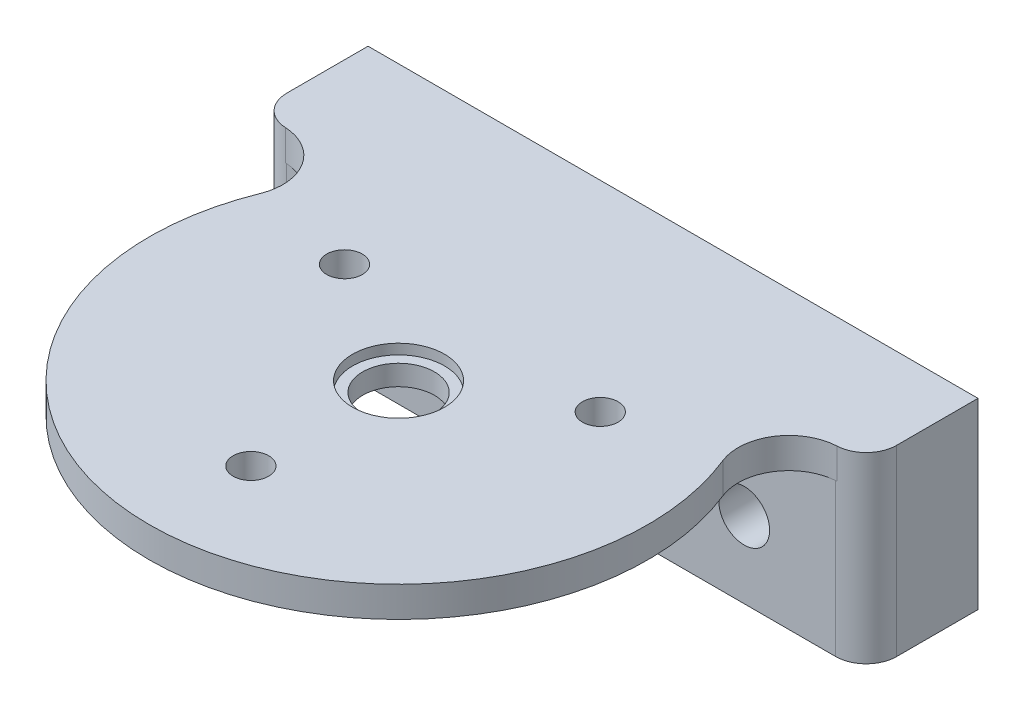
from build123d import *

# Parameters (mm, degrees)
SKETCH1_R                       = 4.525
SKETCH1_R_2                     = 3.525
BOSS_EXTRUDE1_DEPTH             = 2
SKETCH1_5_R                     = 24.525
SKETCH1_5_R_2                   = 4.525
BOSS_EXTRUDE3_DEPTH             = 3
SKETCH2_R                       = 1.75
CUT_EXTRUDE1_DEPTH              = 4.5
CIRPATTERN1_COUNT               = 3
SKETCH9_W                       = 60
SKETCH9_H                       = 11
BOSS_EXTRUDE7_DEPTH             = 15
BOSS_EXTRUDE7_DIRECTION_2_REACH = 36.813
CUT_EXTRUDE3_REACH              = 54.605
SKETCH10_R                      = 2.5
FILLET4_R                       = 3
FILLET5_R                       = 5


with BuildPart() as part:
    # Sketch1 → Boss-Extrude1 (new body)
    with BuildSketch(Plane(origin=(0, 0, 0), x_dir=(1, 0, 0), z_dir=(0, 1, 0))):
        with Locations(Location((0, 0, 0), (0, 0, 270))):
            Circle(SKETCH1_R)
        with Locations(Location((0, 0, 0), (0, 0, 270))):
            Circle(SKETCH1_R_2, mode=Mode.SUBTRACT)
    extrude(amount=BOSS_EXTRUDE1_DEPTH)

    # Sketch1<5> → Boss-Extrude3 (add)
    with BuildSketch(Plane(origin=(0, 0, 0), x_dir=(1, 0, 0), z_dir=(0, 1, 0))):
        with Locations(Location((0, 0, 0), (0, 0, 270))):
            Circle(SKETCH1_5_R)
        with Locations(Location((0, 0, 0), (0, 0, 270))):
            Circle(SKETCH1_5_R_2, mode=Mode.SUBTRACT)
    extrude(amount=BOSS_EXTRUDE3_DEPTH)

    # Sketch2 → Cut-Extrude1 (cut)
    with BuildSketch(Plane(origin=(0, 3, 0), x_dir=(1, 0, 0), z_dir=(0, 1, 0))):
        with Locations(Location((0, -14.525, 0), (0, 0, 270))):
            Circle(SKETCH2_R)
    cut_extrude1 = extrude(amount=-CUT_EXTRUDE1_DEPTH, mode=Mode.SUBTRACT)

    # CirPattern1: Cut-Extrude1 ×3 about axis
    cirpattern1_axis = Axis((0, 0, 0), (0, 1, 0))
    for i in range(1, CIRPATTERN1_COUNT):
        add(cut_extrude1.rotate(cirpattern1_axis, i * 360 / CIRPATTERN1_COUNT), mode=Mode.SUBTRACT)

    # Sketch9 → Boss-Extrude7 (add)
    with BuildSketch(Plane.XZ):
        with Locations((0, -21.5)):
            Rectangle(SKETCH9_W, SKETCH9_H)
    extrude(amount=BOSS_EXTRUDE7_DEPTH)

    # Boss-Extrude7 direction 2: up to this face of the body (flat: up to its plane)
    boss_extrude7_direction_2_end = Plane(part.part.faces().sort_by_distance((0, 3, -23.831328248))[0])
    # Sketch9 → Boss-Extrude7 direction 2 (add, up to the picked face)
    with BuildSketch(Plane.XZ, mode=Mode.PRIVATE) as boss_extrude7_direction_2_sk1:
        with Locations((0, -21.5)):
            Rectangle(SKETCH9_W, SKETCH9_H)
    boss_extrude7_direction_2_tool1 = split(extrude(boss_extrude7_direction_2_sk1.sketch, amount=-BOSS_EXTRUDE7_DIRECTION_2_REACH, mode=Mode.PRIVATE), bisect_by=boss_extrude7_direction_2_end, keep=Keep.BOTH, mode=Mode.PRIVATE)
    add(boss_extrude7_direction_2_tool1.solids().sort_by(Axis((0, 0, -21.5), (0, 1, 0)))[0])

    # Sketch10 → Cut-Extrude3 (cut, up to next)
    with BuildSketch(Plane.XY.offset(-16), mode=Mode.PRIVATE) as cut_extrude3_sk1:
        with Locations((-18, -7.5)):
            Circle(SKETCH10_R)
    cut_extrude3_tool1 = extrude(cut_extrude3_sk1.sketch, amount=-CUT_EXTRUDE3_REACH, mode=Mode.PRIVATE) & part.part
    # Sketch10 → Cut-Extrude3 (cut, up to next)
    with BuildSketch(Plane.XY.offset(-16), mode=Mode.PRIVATE) as cut_extrude3_sk2:
        with Locations(Location((18, -7.5, 0), (0, 0, 180))):
            Circle(SKETCH10_R)
    cut_extrude3_tool2 = extrude(cut_extrude3_sk2.sketch, amount=-CUT_EXTRUDE3_REACH, mode=Mode.PRIVATE) & part.part
    add(cut_extrude3_tool1.solids().sort_by_distance((-18, -7.5, -16))[0], mode=Mode.SUBTRACT)
    add(cut_extrude3_tool2.solids().sort_by_distance((18, -7.5, -16))[0], mode=Mode.SUBTRACT)

    # Fillet4
    fillet4_edges = [part.edges().sort_by_distance(p)[0] for p in [
        (-30, -6, -16),
        (30, -6, -16),
    ]]
    fillet(fillet4_edges, radius=FILLET4_R)

    # Fillet5
    # the kernel refuses this fillet: 5 mm, written as the material it adds along each edge
    with BuildSketch(Plane(origin=(-18.586974606, 3, -16), x_dir=(-0.999999908254526, 0, -0.0004283584240869523), z_dir=(0, -1, 0))) as fillet5_piece_1:
        with BuildLine():
            CenterArc((8.806331501, -4.993993224), FILLET5_R, 92.808774222, 109.061067494)
            Line((4.166169243, -6.856489993), (3.702153017, -7.04273967))
            ThreePointArc((3.702153017, -7.04273967), (1.938057952, -3.516366711), (-0.379079034, -0.326035406))
            Line((-0.379079034, -0.326035406), (0.000214179, 0.499999954))
            ThreePointArc((0.000214179, 0.499999954), (8.413238801, 0.496396164), (8.536816511, 0.499399322))
            Line((8.536816511, 0.499399322), (8.561317874, 0))
        make_face()
    extrude(amount=3)
    with BuildSketch(Plane(origin=(18.586974606, 3, -16), x_dir=(0.999999908254526, 0, -0.0004283584240865375), z_dir=(0, -1, 0))) as fillet5_piece_2:
        with BuildLine():
            CenterArc((8.806331501, 4.993993224), FILLET5_R, 158.130158283, 109.061067494)
            Line((4.166169243, 6.856489993), (3.702153017, 7.04273967))
            ThreePointArc((3.702153017, 7.04273967), (1.938057952, 3.516366711), (-0.379079034, 0.326035406))
            Line((-0.379079034, 0.326035406), (0.000214179, -0.499999954))
            ThreePointArc((0.000214179, -0.499999954), (8.413238801, -0.496396164), (8.536816511, -0.499399322))
            Line((8.536816511, -0.499399322), (8.561317874, 0))
        make_face()
    extrude(amount=3)


solid = part.part
